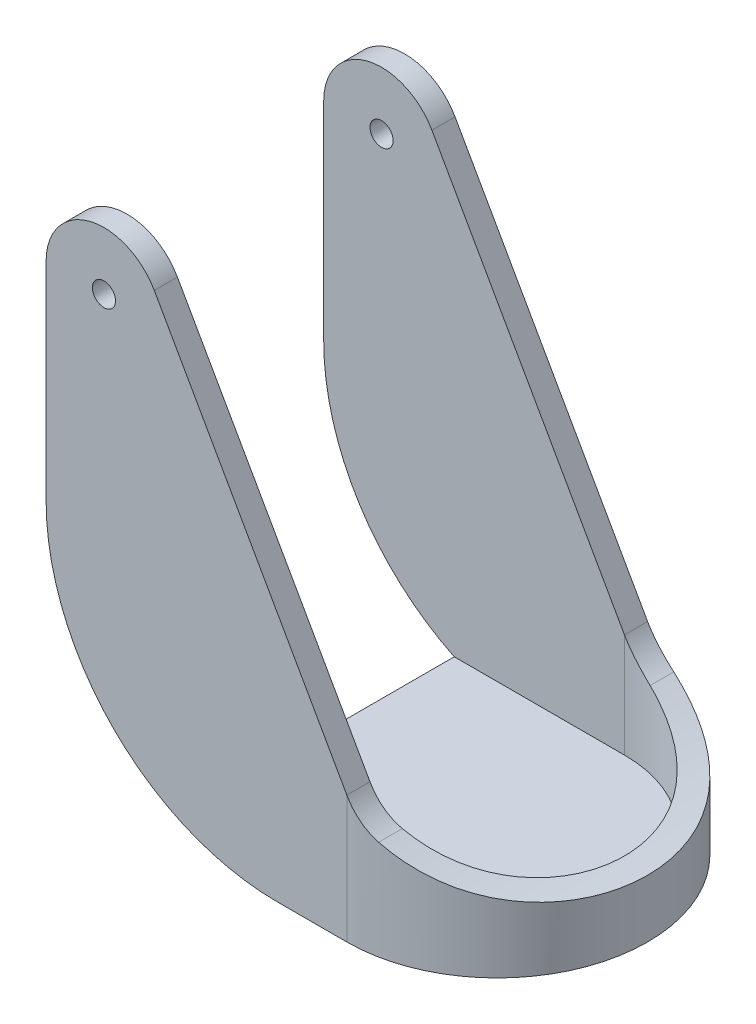
from build123d import *

# Parameters (mm, degrees)
SKETCH_1_R          = 2.15
EXTRUDE_1_DEPTH     = 1
EXTRUDE_2_DEPTH     = 12
SKETCH_8_R          = 1
EXTRUDE_4_DEPTH     = 2
CUT_EXTRUDE_1_DEPTH = 9
CUT_EXTRUDE_2_DEPTH = 20
SKETCH_12_R         = 3
CUT_EXTRUDE_3_DEPTH = 1
FILLET_1_R          = 20
SKETCH_13_W         = 60
SKETCH_13_H         = 50
CUT_EXTRUDE_4_DEPTH = 1


with BuildPart() as part:
    # 草图1 → 凸台-拉伸1 (new body)
    with BuildSketch(Plane(origin=(0, 0, 0), x_dir=(1, 0, 0), z_dir=(0, 1, 0))):
        with BuildLine():
            Line((-24, -22.5), (24, -22.5))
            ThreePointArc((24, -22.5), (26.828427125, -21.328427125), (28, -18.5))
            Line((28, -18.5), (28, 18.5))
            ThreePointArc((28, 18.5), (26.828427125, 21.328427125), (24, 22.5))
            Line((24, 22.5), (-24, 22.5))
            ThreePointArc((-24, 22.5), (-26.828427125, 21.328427125), (-28, 18.5))
            Line((-28, 18.5), (-28, -18.5))
            ThreePointArc((-28, -18.5), (-26.828427125, -21.328427125), (-24, -22.5))
        make_face()
        with Locations(Location((-23, 17.5, 0), (0, 0, 270))):
            Circle(SKETCH_1_R, mode=Mode.SUBTRACT)
        with Locations(Location((-23, -17.5, 0), (0, 0, 270))):
            Circle(SKETCH_1_R, mode=Mode.SUBTRACT)
        with Locations(Location((23, -17.5, 0), (0, 0, 270))):
            Circle(SKETCH_1_R, mode=Mode.SUBTRACT)
        with Locations(Location((23, 17.5, 0), (0, 0, 270))):
            Circle(SKETCH_1_R, mode=Mode.SUBTRACT)
    extrude(amount=EXTRUDE_1_DEPTH)

    # 草图3 → 凸台-拉伸2 (add)
    with BuildSketch(Plane(origin=(0, 1, 0), x_dir=(1, 0, 0), z_dir=(0, 1, 0))):
        with BuildLine():
            Line((-26, -13), (-26, 13))
            Line((-26, 13), (0, 13))
            ThreePointArc((0, 13), (13, 0), (0, -13))
            Line((0, -13), (-26, -13))
        make_face()
    extrude(amount=EXTRUDE_2_DEPTH)

    # 草图8 → 凸台-拉伸4 (add)
    with BuildSketch(Plane.XY.offset(13)):
        with BuildLine():
            Line((-26, 13), (-26, 40))
            ThreePointArc((-26, 40), (-22.271726092, 44.835567469), (-16.646914902, 42.459806928))
            Line((-16.646914902, 42.459806928), (0, 13))
            Line((0, 13), (-26, 13))
        make_face()
        with Locations((-21, 40)):
            Circle(SKETCH_8_R, mode=Mode.SUBTRACT)
    extrude_4 = extrude(amount=-EXTRUDE_4_DEPTH)

    # 镜向1: 凸台-拉伸4 across plane
    add(extrude_4.mirror(Plane.XY))

    # 草图9 → 切除-拉伸1 (cut)
    with BuildSketch(Plane(origin=(0, 13, 0), x_dir=(1, 0, 0), z_dir=(0, 1, 0))):
        with BuildLine():
            Line((-26, 11), (-26, -11))
            Line((-26, -11), (0, -11))
            ThreePointArc((0, -11), (11, 0), (0, 11))
            Line((0, 11), (-26, 11))
        make_face()
    extrude(amount=-CUT_EXTRUDE_1_DEPTH, mode=Mode.SUBTRACT)

    # 草图11 → 切除-拉伸2 (cut, symmetric)
    with BuildSketch(Plane.XY):
        with BuildLine():
            Line((0, 13), (13, 13))
            Line((13, 13), (13, 7))
            ThreePointArc((13, 7), (7.628297221, 8.43537945), (2.507532378, 10.601775609))
            ThreePointArc((2.507532378, 10.601775609), (1.076623467, 11.615671145), (0, 13))
        make_face()
    extrude(amount=CUT_EXTRUDE_2_DEPTH, both=True, mode=Mode.SUBTRACT)

    # 草图12 → 切除-拉伸3 (cut)
    with BuildSketch(Plane(origin=(0, 1, 0), x_dir=(1, 0, 0), z_dir=(0, 1, 0))):
        with BuildLine():
            Line((-26, -13), (0, -13))
            ThreePointArc((0, -13), (13, 0), (0, 13))
            Line((0, 13), (-26, 13))
            Line((-26, 13), (-26, -13))
        make_face()
        with Locations(Location((0, 0, 0), (0, 0, 270))):
            Circle(SKETCH_12_R, mode=Mode.SUBTRACT)
    extrude(amount=CUT_EXTRUDE_3_DEPTH, mode=Mode.SUBTRACT)

    # 圆角1
    # the kernel refuses this fillet: 20 mm, written as the material it takes off along each edge
    with BuildSketch(Plane(origin=(-26, 2, -63), x_dir=(1, 0, 0), z_dir=(0, 0, 1))) as fillet_1_piece_1:
        with BuildLine():
            CenterArc((FILLET_1_R, FILLET_1_R), FILLET_1_R, 180, 90)
            Line((0, FILLET_1_R), (0, 0))
            Line((0, 0), (FILLET_1_R, 0))
        make_face()
    extrude(amount=126, mode=Mode.SUBTRACT)

    # 草图13 → 切除-拉伸4 (cut)
    with BuildSketch(Plane.XZ):
        Rectangle(SKETCH_13_W, SKETCH_13_H)
    extrude(amount=-CUT_EXTRUDE_4_DEPTH, mode=Mode.SUBTRACT)


solid = part.part
